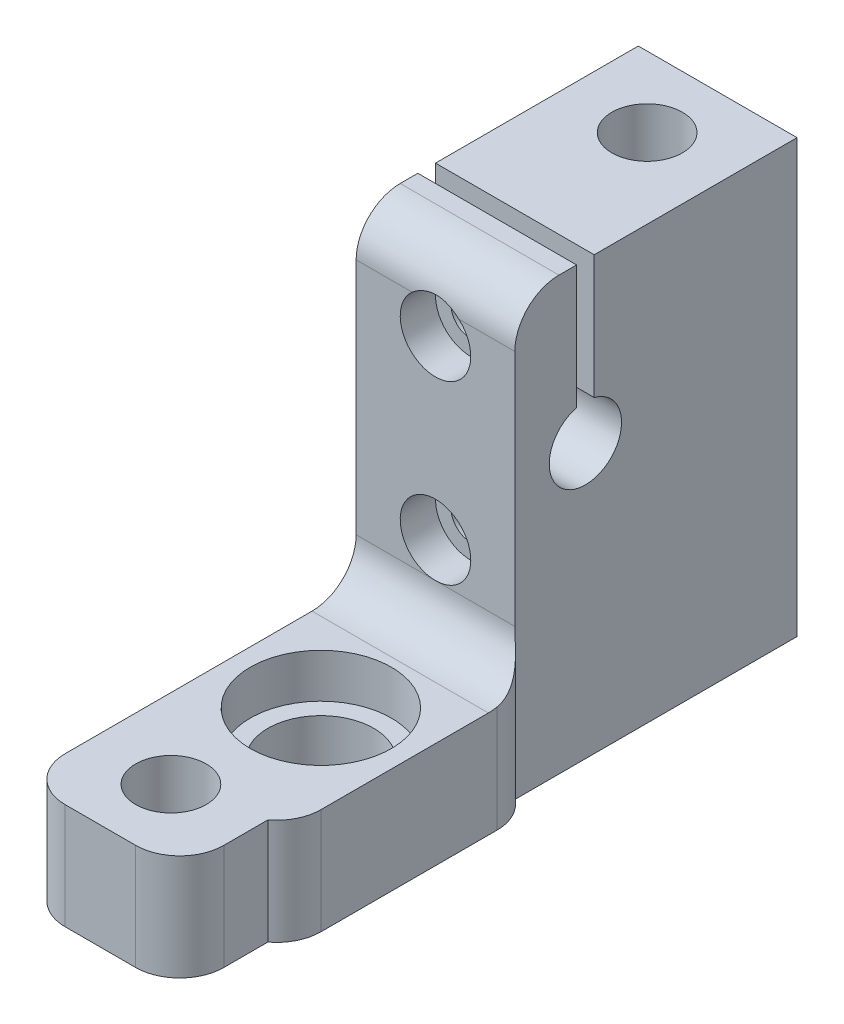
from build123d import *
from build123d.topology import SkipClean

# Parameters (mm, degrees)
SKETCH_2_W          = 18
SKETCH_2_H          = 32
EXTRUDE_1_DEPTH     = 49
SKETCH_3_R          = 4.1
CUT_EXTRUDE_1_DEPTH = 27.3
SKETCH_16_W         = 20
SKETCH_16_H         = 28
EXTRUDE_3_DEPTH     = 12
SKETCH_17_R         = 2.25
CUT_EXTRUDE_3_DEPTH = 66
SKETCH_18_W         = 6
SKETCH_18_H         = 9
SKETCH_18_H_2       = 6
EXTRUDE_4_DEPTH     = 4
SKETCH_19_R         = 4
CUT_EXTRUDE_4_DEPTH = 4
SKETCH_23_W         = 18
SKETCH_23_H         = 10
EXTRUDE_5_DEPTH     = 12
SKETCH_4_R          = 2.25
CUT_EXTRUDE_2_DEPTH = 74.742796258
SKETCH_20_R         = 8
SKETCH_20_R_2       = 6
CUT_EXTRUDE_5_DEPTH = 5
SKETCH_8_W          = 6
SKETCH_8_H          = 3.112620607
SKETCH_8_H_2        = 24.721686793
EXTRUDE_7_DEPTH     = 4
SKETCH_20_4_R       = 6
CUT_EXTRUDE_7_DEPTH = 25
FILLET_1_R          = 5
FILLET_START        = -1
FILLET_2_DEPTH      = 13
FILLET_START_2      = -9
FILLET_2_2_DEPTH    = 18.34805991
FILLET_2_3_DEPTH    = 20
FILLET_2_4_DEPTH    = 19
SKETCH_24_W         = 2
SKETCH_24_H         = 18
CUT_EXTRUDE_8_DEPTH = 23
SKETCH_25_R         = 4
CUT_EXTRUDE_9_DEPTH = 45


with BuildPart() as part:
    # Эскиз2 → Бобышка-Вытянуть1 (new body)
    with BuildSketch(Plane(origin=(0, 0, 0), x_dir=(1, 0, 0), z_dir=(0, 1, 0))):
        Rectangle(SKETCH_2_W, SKETCH_2_H)
    extrude(amount=EXTRUDE_1_DEPTH)

    # Эскиз3 → Вырез-Вытянуть1 (cut)
    with BuildSketch(Plane(origin=(9, 0, -3.279463983), x_dir=(0, 0, -1), z_dir=(1, 0, 0))):
        with Locations((-11.279463983, 31)):
            Circle(SKETCH_3_R)
    extrude(amount=-CUT_EXTRUDE_1_DEPTH, mode=Mode.SUBTRACT)

    # Эскиз16 → Бобышка-Вытянуть3 (add)
    with BuildSketch(Plane.XZ):
        with Locations((1, 30)):
            Rectangle(SKETCH_16_W, SKETCH_16_H)
    extrude(amount=-EXTRUDE_3_DEPTH)

    # Эскиз17 → Вырез-Вытянуть3 (cut)
    with BuildSketch(Plane.XY.offset(16)):
        with Locations((0, 41)):
            Circle(SKETCH_17_R)
        with Locations((0, 21)):
            Circle(SKETCH_17_R)
    extrude(amount=-CUT_EXTRUDE_3_DEPTH, mode=Mode.SUBTRACT)

    # Эскиз18 → Бобышка-Вытянуть4 (add)
    with BuildSketch(Plane(origin=(0, 0, -16), x_dir=(-1, 0, 0), z_dir=(0, 0, -1))):
        with Locations((0, 9.5)):
            Rectangle(SKETCH_18_W, SKETCH_18_H)
        with Locations((0, 31)):
            Rectangle(SKETCH_18_W, SKETCH_18_H_2)
    extrude(amount=EXTRUDE_4_DEPTH)

    # Эскиз19 → Вырез-Вытянуть4 (cut)
    with BuildSketch(Plane.XY.offset(16)):
        with Locations((0, 21)):
            Circle(SKETCH_19_R)
        with Locations((0, 41)):
            Circle(SKETCH_19_R)
    extrude(amount=-CUT_EXTRUDE_4_DEPTH, mode=Mode.SUBTRACT)

    # Эскиз23 → Бобышка-Вытянуть5 (add)
    with BuildSketch(Plane.XZ):
        with Locations((0, 49)):
            Rectangle(SKETCH_23_W, SKETCH_23_H)
    extrude(amount=-EXTRUDE_5_DEPTH)

    # Эскиз4 → Вырез-Вытянуть2 (cut, through all)
    with BuildSketch(Plane.XZ):
        with Locations(Location((0, 46, 0), (0, 0, 270))):
            Circle(SKETCH_4_R)
        with Locations(Location((0, -8, 0), (0, 0, 270))):
            Circle(SKETCH_4_R)
    extrude(amount=-CUT_EXTRUDE_2_DEPTH, mode=Mode.SUBTRACT)

    # Эскиз20 → Вырез-Вытянуть5 (cut)
    with BuildSketch(Plane(origin=(0, 12, 0), x_dir=(1, 0, 0), z_dir=(0, 1, 0))):
        with Locations(Location((1, -30, 0), (0, 0, 270))):
            Circle(SKETCH_20_R)
        with Locations(Location((1, -30, 0), (0, 0, 270))):
            Circle(SKETCH_20_R_2, mode=Mode.SUBTRACT)
    extrude(amount=-CUT_EXTRUDE_5_DEPTH, mode=Mode.SUBTRACT)

    # Эскиз8 → Бобышка-Вытянуть7 (add)
    with BuildSketch(Plane.XZ):
        with Locations((0, 36.443689697)):
            Rectangle(SKETCH_8_W, SKETCH_8_H)
        with Locations((0, 12.360843396)):
            Rectangle(SKETCH_8_W, SKETCH_8_H_2)
    extrude(amount=EXTRUDE_7_DEPTH)

    # Эскиз20<4> → Вырез-Вытянуть7 (cut)
    with BuildSketch(Plane(origin=(0, 12, 0), x_dir=(1, 0, 0), z_dir=(0, 1, 0))):
        with Locations(Location((1, -30, 0), (0, 0, 270))):
            Circle(SKETCH_20_4_R)
    extrude(amount=-CUT_EXTRUDE_7_DEPTH, mode=Mode.SUBTRACT)

    # Скругление1
    # the kernel refuses this fillet: 5 mm, written as the material it takes off along each edge
    with BuildSketch(Plane(origin=(11, -10, 44), x_dir=(0, 0, -1), z_dir=(0, 1, 0))) as fillet_1_piece_1:
        with BuildLine():
            CenterArc((4, 5), FILLET_1_R, 216.869897646, 53.130102354)
            Line((0, 2), (-0.08, 1.94))
            ThreePointArc((-0.08, 1.94), (-0.1, 1), (-0.1, 0))
            Line((-0.1, 0), (0, -0.1))
            Line((0, -0.1), (4, -0.1))
            Line((4, -0.1), (4, 0))
        make_face()
    extrude(amount=32, mode=Mode.SUBTRACT)
    with BuildSketch(Plane(origin=(11, -10, 16), x_dir=(-1, 0, 0), z_dir=(0, 1, 0))) as fillet_1_piece_2:
        with BuildLine():
            CenterArc((5, 4), FILLET_1_R, 180, 53.130102354)
            Line((0, 4), (-0.1, 4))
            Line((-0.1, 4), (-0.1, 0))
            Line((-0.1, 0), (0, -0.1))
            ThreePointArc((0, -0.1), (1, -0.1), (1.94, -0.08))
            Line((1.94, -0.08), (2, 0))
        make_face()
    extrude(amount=32, mode=Mode.SUBTRACT)

    # Скругление2: read off the stored shape, not the designer's step
    # Скругление2 outline → Скругление2 (cut)
    with BuildSketch(Plane(origin=(0, 0, 0), x_dir=(1, 0, 0), z_dir=(0, 1, 0)).offset(FILLET_START)):
        with BuildLine():
            Line((9, -54), (9, -49))
            ThreePointArc((9, -49), (7.535533906, -52.535533906), (4, -54))
            Line((4, -54), (9, -54))
        make_face()
    extrude(amount=FILLET_2_DEPTH, mode=Mode.SUBTRACT)

    # Fillet 2 2 outline → Fillet 2 2 (cut)
    with BuildSketch(Plane.YZ.offset(FILLET_START_2)):
        with BuildLine():
            Line((49, 16), (44, 16))
            ThreePointArc((44, 16), (47.535533906, 14.535533906), (49, 11))
            Line((49, 11), (49, 16))
        make_face()
    extrude(amount=FILLET_2_2_DEPTH, mode=Mode.SUBTRACT)

    # Fillet 2 3 outline → Fillet 2 3 (add)
    with BuildSketch(Plane.YZ.offset(FILLET_START_2)):
        with BuildLine():
            Line((12, 16), (17, 16))
            ThreePointArc((17, 16), (13.464466094, 17.464466094), (12, 21))
            Line((12, 21), (12, 16))
        make_face()
    extrude(amount=FILLET_2_3_DEPTH)

    # Fillet 2 4 outline → Fillet 2 4 (cut)
    with SkipClean():  # the faces are left unmerged after this step: merging them gives an invalid solid
        with BuildSketch(Plane(origin=(0, 0, 0), x_dir=(1, 0, 0), z_dir=(0, 1, 0)).offset(FILLET_START)):
            with BuildLine():
                ThreePointArc((8.999983996, -15.999987997), (10.472131482, -17.763923076), (11, -20))
                Line((11, -20), (11, -16))
                Line((11, -16), (8.999983996, -15.999987997))
            make_face()
            with BuildLine():
                ThreePointArc((-4, -54), (-7.535533906, -52.535533906), (-9, -49))
                Line((-9, -49), (-9, -54))
                Line((-9, -54), (-4, -54))
            make_face()
        extrude(amount=FILLET_2_4_DEPTH, mode=Mode.SUBTRACT)

    # Эскиз24 → Вырез-Вытянуть8 (cut)
    with SkipClean():  # the faces are left unmerged after this step: merging them gives an invalid solid
        with BuildSketch(Plane(origin=(9, 0, 0), x_dir=(0, 0, -1), z_dir=(1, 0, 0))):
            with Locations((-8, 40)):
                Rectangle(SKETCH_24_W, SKETCH_24_H)
        extrude(amount=-CUT_EXTRUDE_8_DEPTH, mode=Mode.SUBTRACT)

    # Эскиз25 → Вырез-Вытянуть9 (cut)
    with SkipClean():  # the faces are left unmerged after this step: merging them gives an invalid solid
        with BuildSketch(Plane(origin=(0, 49, 0), x_dir=(1, 0, 0), z_dir=(0, 1, 0))):
            with Locations(Location((0, 8, 0), (0, 0, 270))):
                Circle(SKETCH_25_R)
            with Locations(Location((0, -46, 0), (0, 0, 270))):
                Circle(SKETCH_25_R)
        extrude(amount=-CUT_EXTRUDE_9_DEPTH, mode=Mode.SUBTRACT)


solid = part.part
